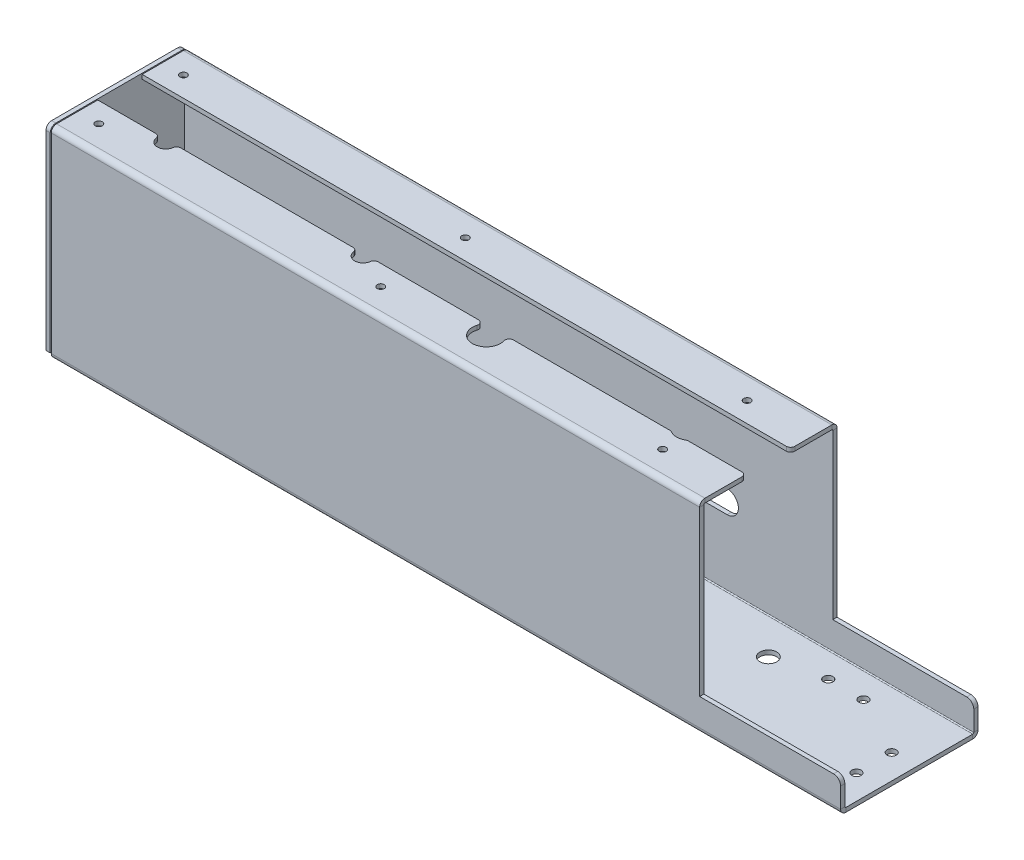
from build123d import *

# Parameters (mm, degrees)
SKETCH_1_W                         = 560
SKETCH_1_H                         = 90
SM_BASE_FLANGE_1_DEPTH             = 3
SM_EDGE_FLANGE_4_DEPTH             = 560
SM_START                           = 3
SM_EDGE_FLANGE_4_FLAT_DEPTH        = 3
SM_EDGE_FLANGE_4_BEND_DEPTH        = 560
SM_EDGE_FLANGE_4_FLAT_2_DEPTH      = 3
SM_EDGE_FLANGE_5_STRIP_W           = 13.4732
SM_EDGE_FLANGE_5_STRIP_H           = 3
SM_EDGE_FLANGE_5_STRIP_CUT_DEPTH   = 460
SM_EDGE_FLANGE_5_STRIP_2_W         = 13.4732
SM_EDGE_FLANGE_5_STRIP_2_H         = 3
SM_EDGE_FLANGE_5_STRIP_CUT_2_DEPTH = 460
SM_EDGE_FLANGE_5_DEPTH             = 460
SM_EDGE_FLANGE_5_BEND_DEPTH        = 460
FILLET_2_R                         = 5
HOLE_WIZARD_M6_1_D                 = 5
HOLE_WIZARD_M6_1_DEPTH             = 3
HOLE_WIZARD_M6_1_2_D               = 6.6
HOLE_WIZARD_M6_1_2_DEPTH           = 3
SKETCH_62_R                        = 10
SKETCH_62_R_2                      = 6
CUT_EXTRUDE_1_DEPTH                = 10
FILLET_3_R                         = 3
HOLE_WIZARD_M8_1_D                 = 9
SM_START_2                         = -44.7366
SM_EDGE_FLANGE_6_DEPTH             = 89.4732
SM_START_3                         = -45
SM_EDGE_FLANGE_6_2_DEPTH           = 90
SM_START_4                         = -283.7366
SM_EDGE_FLANGE_6_3_DEPTH           = 3
CUT_EXTRUDE_2_REACH                = 323.451
SKETCH_69_R                        = 6
CUT_EXTRUDE_3_REACH                = 333.07
FILLET_4_R                         = 3


with BuildPart() as part:
    # 베이스-플랜지1: sheet metal written as solids
    # Sketch 1 → 베이스-플랜지1 (new body)
    with BuildSketch(Plane(origin=(0, 0, 0), x_dir=(1, 0, 0), z_dir=(0, 1, 0))):
        Rectangle(SKETCH_1_W, SKETCH_1_H)
    extrude(amount=-SM_BASE_FLANGE_1_DEPTH)

    # 모서리 플랜지4: sheet metal written as solids
    # 모서리 플랜지4 bend section (on a plane across the edge) → 모서리 플랜지4 (add)
    with BuildSketch(Plane(origin=(-280, 0, 45.7366), x_dir=(0, 0, -1), z_dir=(1, 0, 0))):
        with BuildLine():
            Line((-3, 0.7366), (0, 0.7366))
            ThreePointArc((0, 0.7366), (0.215745145, 0.215745145), (0.7366, 0))
            Line((0.7366, 0), (0.7366, -3))
            ThreePointArc((0.7366, -3), (-1.905575199, -1.905575199), (-3, 0.7366))
        make_face()
    extrude(amount=SM_EDGE_FLANGE_4_DEPTH)

    # 모서리 플랜지4 profile (on flange) → 모서리 플랜지4 flat (add)
    with BuildSketch(Plane.XY.offset(45.7366).offset(SM_START)):
        Polygon((-280, 140), (-280, 0.7366), (280, 0.7366), (280, 20), (180, 20), (180, 140), align=None)
    extrude(amount=-SM_EDGE_FLANGE_4_FLAT_DEPTH)

    # 모서리 플랜지4 bend section 2 (on a plane across the edge) → 모서리 플랜지4 bend (add)
    with BuildSketch(Plane(origin=(280, 0, -45.7366), x_dir=(0, 0, 1), z_dir=(-1, 0, 0))):
        with BuildLine():
            Line((-3, 0.7366), (0, 0.7366))
            ThreePointArc((0, 0.7366), (0.215745145, 0.215745145), (0.7366, 0))
            Line((0.7366, 0), (0.7366, -3))
            ThreePointArc((0.7366, -3), (-1.905575199, -1.905575199), (-3, 0.7366))
        make_face()
    extrude(amount=SM_EDGE_FLANGE_4_BEND_DEPTH)

    # 모서리 플랜지4 profile 2 (on flange) → 모서리 플랜지4 flat 2 (add)
    with BuildSketch(Plane(origin=(0, 0, -45.7366), x_dir=(-1, 0, 0), z_dir=(0, 0, -1)).offset(SM_START)):
        Polygon((-280, 20), (-280, 0.7366), (280, 0.7366), (280, 140), (-180, 140), (-180, 20), align=None)
    extrude(amount=-SM_EDGE_FLANGE_4_FLAT_2_DEPTH)

    # 모서리 플랜지5: sheet metal written as solids
    # 모서리 플랜지5 strip (on a plane across the edge) → 모서리 플랜지5 strip cut (cut)
    with BuildSketch(Plane(origin=(-280, 140, 45.7366), x_dir=(0, -1, 0), z_dir=(1, 0, 0))):
        with Locations((-3, -1.5)):
            Rectangle(SM_EDGE_FLANGE_5_STRIP_W, SM_EDGE_FLANGE_5_STRIP_H)
    extrude(amount=SM_EDGE_FLANGE_5_STRIP_CUT_DEPTH, mode=Mode.SUBTRACT)

    # 모서리 플랜지5 strip 2 (on a plane across the edge) → 모서리 플랜지5 strip cut 2 (cut)
    with BuildSketch(Plane(origin=(180, 140, -45.7366), x_dir=(0, -1, 0), z_dir=(-1, 0, 0))):
        with Locations((-3, -1.5)):
            Rectangle(SM_EDGE_FLANGE_5_STRIP_2_W, SM_EDGE_FLANGE_5_STRIP_2_H)
    extrude(amount=SM_EDGE_FLANGE_5_STRIP_CUT_2_DEPTH, mode=Mode.SUBTRACT)

    # 모서리 플랜지5 section (on a plane across the edge) → 모서리 플랜지5 (add)
    with BuildSketch(Plane(origin=(-280, 140, 45.7366), x_dir=(0, -1, 0), z_dir=(1, 0, 0))):
        with BuildLine():
            Line((0, 0.7366), (0, 30))
            Line((0, 30), (3, 30))
            Line((3, 30), (3, 0.7366))
            ThreePointArc((3, 0.7366), (3.215745145, 0.215745145), (3.7366, 0))
            Line((3.7366, 0), (3.7366, -3))
            ThreePointArc((3.7366, -3), (1.094424801, -1.905575199), (0, 0.7366))
        make_face()
    extrude(amount=SM_EDGE_FLANGE_5_DEPTH)

    # 모서리 플랜지5 section 2 (on a plane across the edge) → 모서리 플랜지5 bend (add)
    with BuildSketch(Plane(origin=(180, 140, -45.7366), x_dir=(0, -1, 0), z_dir=(-1, 0, 0))):
        with BuildLine():
            Line((0, 0.7366), (0, 30))
            Line((0, 30), (3, 30))
            Line((3, 30), (3, 0.7366))
            ThreePointArc((3, 0.7366), (3.215745145, 0.215745145), (3.7366, 0))
            Line((3.7366, 0), (3.7366, -3))
            ThreePointArc((3.7366, -3), (1.094424801, -1.905575199), (0, 0.7366))
        make_face()
    extrude(amount=SM_EDGE_FLANGE_5_BEND_DEPTH)

    # 필렛2
    fillet_2_edges = [part.edges().sort_by_distance(p)[0] for p in [
        (280, 20, 47.2366),
        (280, 20, -47.2366),
    ]]
    fillet(fillet_2_edges, radius=FILLET_2_R)

    # Hole Wizard M6 _ _ _ _1
    with Locations(Plane(origin=(0, 140, 0), x_dir=(1, 0, 0), z_dir=(0, 1, 0))):
        with Locations((135, -30), (135, 30), (-65, 30), (-65, -30), (-265, -30), (-265, 30)):
            Hole(HOLE_WIZARD_M6_1_D / 2, depth=HOLE_WIZARD_M6_1_DEPTH)

    # Hole Wizard M6 _ _1 2
    with Locations(Plane(origin=(0, -3, 0), x_dir=(-1, 0, 0), z_dir=(0, -1, 0))):
        with Locations((90, -17.5), (90, 2.5), (230, -17.5), (230, 2.5), (-2.5, 7.5), (-2.5, -22.5), (-195, 27.5), (-220, 27.5), (-262.5, 5), (-262.5, -20)):
            Hole(HOLE_WIZARD_M6_1_2_D / 2, depth=HOLE_WIZARD_M6_1_2_DEPTH)

    # 스케치62 → 컷-돌출1 (cut)
    with BuildSketch(Plane(origin=(0, 140, 0), x_dir=(1, 0, 0), z_dir=(0, 1, 0))):
        with Locations((2.5, -22.5)):
            Circle(SKETCH_62_R)
        with Locations((-90, -17.5)):
            Circle(SKETCH_62_R_2)
        with Locations((-230, -17.5)):
            Circle(SKETCH_62_R_2)
        with Locations((132.5, -7.5)):
            Circle(SKETCH_62_R)
    extrude(amount=-CUT_EXTRUDE_1_DEPTH, mode=Mode.SUBTRACT)

    # 필렛3
    fillet_3_edges = [part.edges().sort_by_distance(p)[0] for p in [
        (-4.865895766, 138.5, 15.7366),
        (9.865895766, 138.5, 15.7366),
        (-95.735017039, 138.5, 15.7366),
        (-84.264982961, 138.5, 15.7366),
        (-235.735017039, 138.5, 15.7366),
        (-224.264982961, 138.5, 15.7366),
        (126.829160517, 138.5, 15.7366),
        (138.170839483, 138.5, 15.7366),
    ]]
    fillet(fillet_3_edges, radius=FILLET_3_R)

    # M8 여유 구멍1 (through all)
    with Locations(Plane(origin=(0, -3, 0), x_dir=(-1, 0, 0), z_dir=(0, -1, 0))):
        with Locations((-132.5, -7.5)):
            Hole(HOLE_WIZARD_M8_1_D / 2)

    # 모서리 플랜지6: read off the stored shape, not the designer's step
    # 모서리 플랜지6 outline → 모서리 플랜지6 (add)
    with BuildSketch(Plane.XY.offset(SM_START_2)):
        with BuildLine():
            Line((-280.7366, 140), (-283.7366, 140))
            Line((-283.7366, 140), (-283.7366, 0.7366))
            ThreePointArc((-283.7366, 0.7366), (-282.642175199, -1.905575199), (-280, -3))
            Line((-280, -3), (-280, 0))
            ThreePointArc((-280, 0), (-280.520854855, 0.215745145), (-280.7366, 0.7366))
            Line((-280.7366, 0.7366), (-280.7366, 140))
        make_face()
    extrude(amount=SM_EDGE_FLANGE_6_DEPTH)

    # Sm Edge Flange 6 2 outline → Sm Edge Flange 6 2 (add)
    with BuildSketch(Plane.XY.offset(SM_START_3)):
        with BuildLine():
            Line((-280.7366, 0.7366), (-283.7366, 0.7366))
            ThreePointArc((-283.7366, 0.7366), (-282.642175199, -1.905575199), (-280, -3))
            Line((-280, -3), (-280, 0))
            ThreePointArc((-280, 0), (-280.520854855, 0.215745145), (-280.7366, 0.7366))
        make_face()
    extrude(amount=SM_EDGE_FLANGE_6_2_DEPTH)

    # Sm Edge Flange 6 3 outline → Sm Edge Flange 6 3 (add)
    with BuildSketch(Plane.YZ.offset(SM_START_4)):
        with BuildLine():
            Line((0.7366, -48.7366), (136, -48.7366))
            ThreePointArc((136, -48.7366), (138.828427125, -47.565027125), (140, -44.7366))
            Line((140, -44.7366), (0.7366, -44.7366))
            Line((0.7366, -44.7366), (0.7366, -48.7366))
        make_face()
        with BuildLine():
            Line((136, 48.7366), (0.7366, 48.7366))
            Line((0.7366, 48.7366), (0.7366, 44.7366))
            Line((0.7366, 44.7366), (140, 44.7366))
            ThreePointArc((140, 44.7366), (138.828427125, 47.565027125), (136, 48.7366))
        make_face()
    extrude(amount=SM_EDGE_FLANGE_6_3_DEPTH)

    # 스케치69 → 컷-돌출2 (cut, up to next)
    with BuildSketch(Plane.XZ.offset(3), mode=Mode.PRIVATE) as cut_extrude_2_sk1:
        with Locations(Location((-105, 34, 0), (0, 0, 270))):
            Circle(SKETCH_69_R)
    cut_extrude_2_tool1 = extrude(cut_extrude_2_sk1.sketch, amount=-CUT_EXTRUDE_2_REACH, mode=Mode.PRIVATE) & part.part
    # 스케치69 → 컷-돌출2 (cut, up to next)
    with BuildSketch(Plane.XZ.offset(3), mode=Mode.PRIVATE) as cut_extrude_2_sk2:
        with Locations(Location((20, 34, 0), (0, 0, 270))):
            Circle(SKETCH_69_R)
    cut_extrude_2_tool2 = extrude(cut_extrude_2_sk2.sketch, amount=-CUT_EXTRUDE_2_REACH, mode=Mode.PRIVATE) & part.part
    # 스케치69 → 컷-돌출2 (cut, up to next)
    with BuildSketch(Plane.XZ.offset(3), mode=Mode.PRIVATE) as cut_extrude_2_sk3:
        with Locations(Location((160, -20, 0), (0, 0, 270))):
            Circle(SKETCH_69_R)
    cut_extrude_2_tool3 = extrude(cut_extrude_2_sk3.sketch, amount=-CUT_EXTRUDE_2_REACH, mode=Mode.PRIVATE) & part.part
    # 스케치69 → 컷-돌출2 (cut, up to next)
    with BuildSketch(Plane.XZ.offset(3), mode=Mode.PRIVATE) as cut_extrude_2_sk4:
        with BuildLine():
            Line((-244, 12.5), (-244, 2.5))
            ThreePointArc((-244, 2.5), (-250, -3.5), (-256, 2.5))
            Line((-256, 2.5), (-256, 12.5))
            ThreePointArc((-256, 12.5), (-250, 18.5), (-244, 12.5))
        make_face()
    cut_extrude_2_tool4 = extrude(cut_extrude_2_sk4.sketch, amount=-CUT_EXTRUDE_2_REACH, mode=Mode.PRIVATE) & part.part
    add(cut_extrude_2_tool1.solids().sort_by_distance((-105, -3, 34))[0], mode=Mode.SUBTRACT)
    add(cut_extrude_2_tool2.solids().sort_by_distance((20, -3, 34))[0], mode=Mode.SUBTRACT)
    add(cut_extrude_2_tool3.solids().sort_by_distance((160, -3, -20))[0], mode=Mode.SUBTRACT)
    add(cut_extrude_2_tool4.solids().sort_by_distance((-250, -3, 7.5))[0], mode=Mode.SUBTRACT)

    # 스케치70 → 컷-돌출3 (cut, up to next)
    with BuildSketch(Plane(origin=(0, 0, -48.7366), x_dir=(-1, 0, 0), z_dir=(0, 0, -1)), mode=Mode.PRIVATE) as cut_extrude_3_sk1:
        with BuildLine():
            Line((-75, 47), (-105, 47))
            ThreePointArc((-105, 47), (-113, 55), (-105, 63))
            Line((-105, 63), (-75, 63))
            ThreePointArc((-75, 63), (-67, 55), (-75, 47))
        make_face()
    cut_extrude_3_tool1 = extrude(cut_extrude_3_sk1.sketch, amount=-CUT_EXTRUDE_3_REACH, mode=Mode.PRIVATE) & part.part
    add(cut_extrude_3_tool1.solids().sort_by_distance((90, 55, -48.7366))[0], mode=Mode.SUBTRACT)

    # 필렛4
    fillet_4_edges = [part.edges().sort_by_distance(p)[0] for p in [
        (180, 138.5, -15.7366),
        (180, 138.5, 15.7366),
    ]]
    fillet(fillet_4_edges, radius=FILLET_4_R)


solid = part.part
